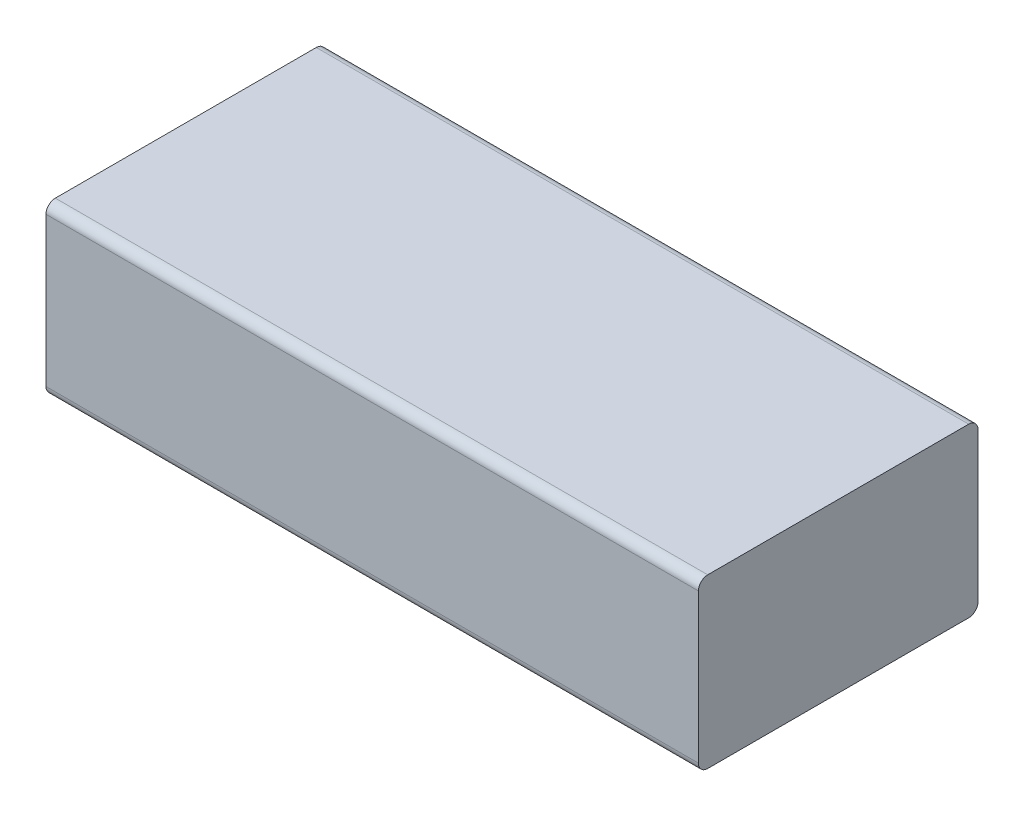
from build123d import *

# Parameters (mm, degrees)
SKETCH1_W           = 88.9
SKETCH1_H           = 38.1
BOSS_EXTRUDE1_DEPTH = 22.86
FILLET1_R           = 1.27


with BuildPart() as part:
    # Sketch1 → Boss-Extrude1 (new body)
    with BuildSketch(Plane(origin=(0, 0, 0), x_dir=(1, 0, 0), z_dir=(0, 1, 0))):
        Rectangle(SKETCH1_W, SKETCH1_H)
    extrude(amount=BOSS_EXTRUDE1_DEPTH)

    # Fillet1
    fillet1_edges = [part.edges().sort_by_distance(p)[0] for p in [
        (0, 0, -19.05),
        (0, 0, 19.05),
        (0, 22.86, -19.05),
        (0, 22.86, 19.05),
    ]]
    fillet(fillet1_edges, radius=FILLET1_R)


solid = part.part
